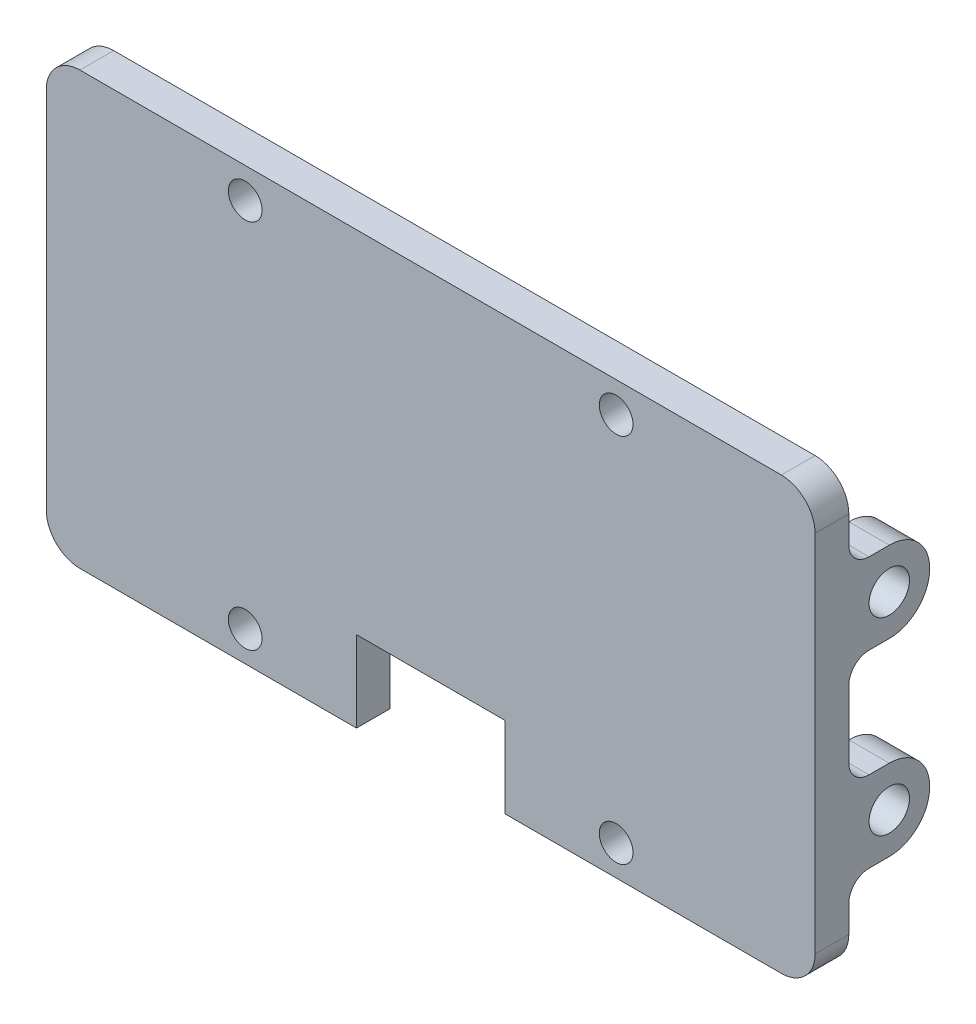
from build123d import *

# Parameters (mm, degrees)
SKETCH_1_R      = 1.25
EXTRUDE_1_DEPTH = 2.5
SKETCH_3_R      = 1.5
EXTRUDE_2_DEPTH = 3
EXTRUDE_START   = -3
SKETCH_4_R      = 1.5
EXTRUDE_3_DEPTH = 3
FILLET_1_R      = 1.5
FILLET_2_R      = 2.5


with BuildPart() as part:
    # 草图1 → 凸台-拉伸1 (new body)
    with BuildSketch(Plane.XY):
        Polygon((-28.5, -16), (-16, -16), (-5.5, -16), (-5.5, -10), (0, -10), (5.5, -10), (5.5, -16), (16, -16), (28.5, -16), (28.5, 16), (16, 16), (-16, 16), (-28.5, 16), align=None)
        with Locations((-13.75, -13.75)):
            Circle(SKETCH_1_R, mode=Mode.SUBTRACT)
        with Locations((13.75, -13.75)):
            Circle(SKETCH_1_R, mode=Mode.SUBTRACT)
        with Locations((-13.75, 13.75)):
            Circle(SKETCH_1_R, mode=Mode.SUBTRACT)
        with Locations((13.75, 13.75)):
            Circle(SKETCH_1_R, mode=Mode.SUBTRACT)
    extrude(amount=EXTRUDE_1_DEPTH)

    # 草图3 → 凸台-拉伸2 (add)
    # profile 1 of 2: a face of its own
    with BuildSketch(Plane.ZY.offset(28.5)):
        with BuildLine():
            Line((-3, 4), (0, 4))
            Line((0, 4), (0, 10))
            Line((0, 10), (-3, 10))
            ThreePointArc((-3, 10), (-6, 7), (-3, 4))
        make_face()
        with Locations((-3, 7)):
            Circle(SKETCH_3_R, mode=Mode.SUBTRACT)
    # profile 2 of 2: a face of its own
    with BuildSketch(Plane.ZY.offset(28.5)):
        with BuildLine():
            Line((-3, -4), (0, -4))
            Line((0, -4), (0, -10))
            Line((0, -10), (-3, -10))
            ThreePointArc((-3, -10), (-6, -7), (-3, -4))
        make_face()
        with Locations((-3, -7)):
            Circle(SKETCH_3_R, mode=Mode.SUBTRACT)
    extrude(amount=-EXTRUDE_2_DEPTH)

    # 草图4 → 凸台-拉伸3 (add)
    # profile 1 of 2: a face of its own
    with BuildSketch(Plane(origin=(28.5, 0, 0), x_dir=(0, 0, -1), z_dir=(1, 0, 0)).offset(EXTRUDE_START)):
        with BuildLine():
            Line((3, -4), (0, -4))
            Line((0, -4), (0, -10))
            Line((0, -10), (3, -10))
            ThreePointArc((3, -10), (6, -7), (3, -4))
        make_face()
        with Locations(Location((3, -7, 0), (0, 0, 180))):
            Circle(SKETCH_4_R, mode=Mode.SUBTRACT)
    # profile 2 of 2: a face of its own
    with BuildSketch(Plane(origin=(28.5, 0, 0), x_dir=(0, 0, -1), z_dir=(1, 0, 0)).offset(EXTRUDE_START)):
        with BuildLine():
            Line((3, 10), (0, 10))
            Line((0, 10), (0, 4))
            Line((0, 4), (3, 4))
            ThreePointArc((3, 4), (6, 7), (3, 10))
        make_face()
        with Locations(Location((3, 7, 0), (0, 0, 180))):
            Circle(SKETCH_4_R, mode=Mode.SUBTRACT)
    extrude(amount=EXTRUDE_3_DEPTH)

    # 圆角1
    fillet_1_edges = [part.edges().sort_by_distance(p)[0] for p in [
        (-25.5, 7, 0),
        (-27, 10, 0),
        (-27, 4, 0),
        (-25.5, -7, 0),
        (-27, -4, 0),
        (-27, -10, 0),
        (25.5, -7, 0),
        (27, -10, 0),
        (27, -4, 0),
        (25.5, 7, 0),
        (27, 4, 0),
        (27, 10, 0),
    ]]
    fillet(fillet_1_edges, radius=FILLET_1_R - 0.0001)  # a hair under: the kernel refuses the full size

    # 圆角2
    fillet_2_edges = [part.edges().sort_by_distance(p)[0] for p in [
        (-28.5, -16, 1.25),
        (-28.5, 16, 1.25),
        (28.5, 16, 1.25),
        (28.5, -16, 1.25),
    ]]
    fillet(fillet_2_edges, radius=FILLET_2_R)


solid = part.part
